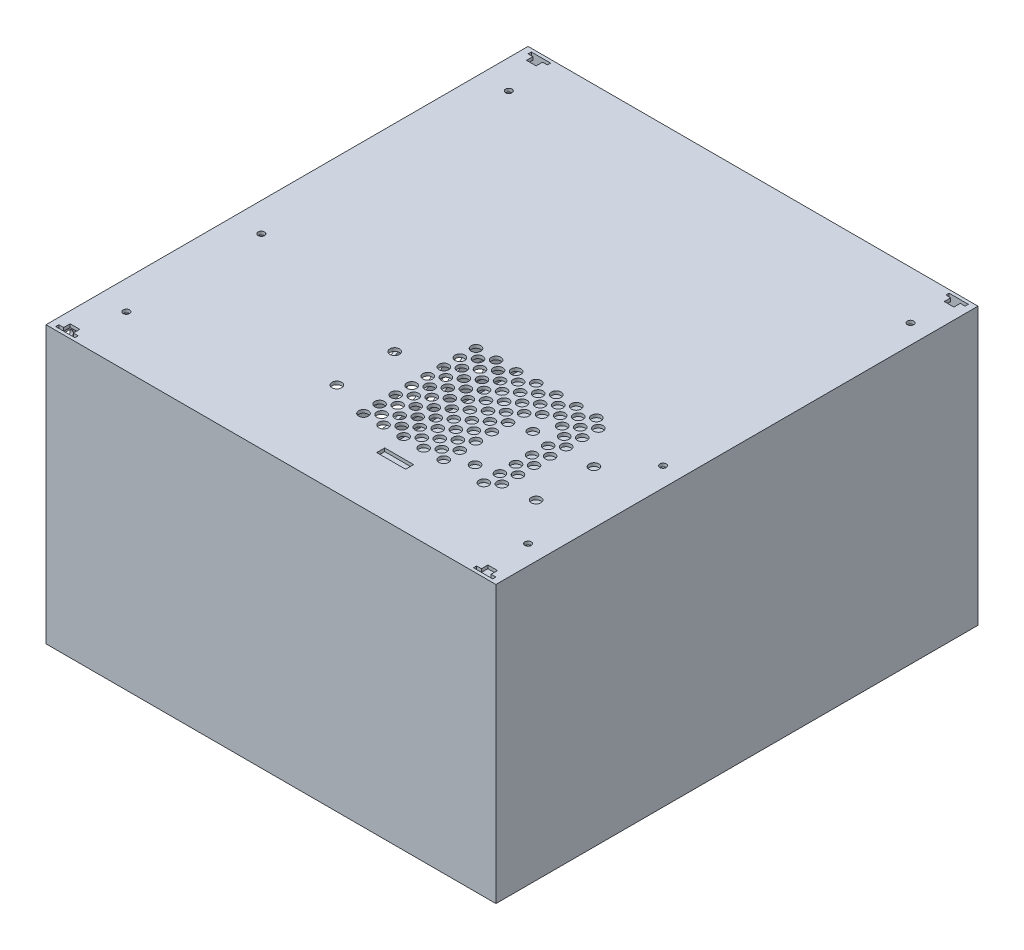
from build123d import *

# Parameters (mm, degrees)
BOSS_EXTRUDE1_DEPTH      = 43
BOSS_EXTRUDE1_DEPTH_BACK = 43
SKETCH1_W                = 140
SKETCH1_H                = 150
SKETCH1_W_2              = 138
SKETCH1_H_2              = 148
SKETCH3_W                = 140
SKETCH3_H                = 150
BOSS_EXTRUDE2_DEPTH      = 1
SKETCH4_W                = 140
SKETCH4_H                = 150
BOSS_EXTRUDE3_DEPTH      = 1
CUT_EXTRUDE2_START       = -1
CUT_EXTRUDE2_OUTLINE_R   = 1
CUT_EXTRUDE2_OUTLINE_R_2 = 1.5
CUT_EXTRUDE2_OUTLINE_W   = 9
CUT_EXTRUDE2_OUTLINE_H   = 2.5
CUT_EXTRUDE2_DEPTH       = 1
SKETCH6_R                = 1.5
SKETCH6_R_2              = 2.5
SKETCH6_R_3              = 2
SKETCH6_R_4              = 1
CUT_EXTRUDE3_DEPTH       = 1


# Read off the part's stored shape, not the designer's step: Cut-Extrude2
with BuildPart() as part:
    # Sketch1 → Boss-Extrude1 (new, two sides: drawn at the far end of the back side and taken through both)
    with BuildSketch(Plane(origin=(0, 0, 0), x_dir=(1, 0, 0), z_dir=(0, 1, 0)).offset(-BOSS_EXTRUDE1_DEPTH_BACK)):
        Rectangle(SKETCH1_W, SKETCH1_H)
        Rectangle(SKETCH1_W_2, SKETCH1_H_2, mode=Mode.SUBTRACT)
    extrude(amount=BOSS_EXTRUDE1_DEPTH + BOSS_EXTRUDE1_DEPTH_BACK)

    # Sketch3 → Boss-Extrude2 (add)
    with BuildSketch(Plane(origin=(0, 43, 0), x_dir=(1, 0, 0), z_dir=(0, 1, 0))):
        Rectangle(SKETCH3_W, SKETCH3_H)
    extrude(amount=-BOSS_EXTRUDE2_DEPTH)

    # Sketch4 → Boss-Extrude3 (add)
    with BuildSketch(Plane.XZ.offset(43)):
        Rectangle(SKETCH4_W, SKETCH4_H)
    extrude(amount=-BOSS_EXTRUDE3_DEPTH)

    # Cut-Extrude2 outline → Cut-Extrude2 (cut)
    with BuildSketch(Plane(origin=(0, 43, 0), x_dir=(1, 0, 0), z_dir=(0, 1, 0)).offset(CUT_EXTRUDE2_START)):
        with Locations((-61, 60)):
            Circle(CUT_EXTRUDE2_OUTLINE_R)
        with Locations((12.662498999, -17)):
            Circle(CUT_EXTRUDE2_OUTLINE_R_2)
        with Locations((12.662498999, -22)):
            Circle(CUT_EXTRUDE2_OUTLINE_R_2)
        with Locations((12.662498999, -27)):
            Circle(CUT_EXTRUDE2_OUTLINE_R_2)
        with Locations((12.662498999, -32)):
            Circle(CUT_EXTRUDE2_OUTLINE_R_2)
        with Locations((12.662498999, -37)):
            Circle(CUT_EXTRUDE2_OUTLINE_R_2)
        with Locations((12.662498999, -42)):
            Circle(CUT_EXTRUDE2_OUTLINE_R_2)
        with Locations((15.78, -39.5)):
            Circle(CUT_EXTRUDE2_OUTLINE_R_2)
        with Locations((15.78, -34.5)):
            Circle(CUT_EXTRUDE2_OUTLINE_R_2)
        with Locations((15.78, -29.5)):
            Circle(CUT_EXTRUDE2_OUTLINE_R_2)
        with Locations((15.78, -24.5)):
            Circle(CUT_EXTRUDE2_OUTLINE_R_2)
        with Locations((15.78, -14.5)):
            Circle(CUT_EXTRUDE2_OUTLINE_R_2)
        with Locations((15.78, -19.5)):
            Circle(CUT_EXTRUDE2_OUTLINE_R_2)
        with Locations((12.662498999, -47)):
            Circle(CUT_EXTRUDE2_OUTLINE_R_2)
        with Locations((9.54, -49.5)):
            Circle(CUT_EXTRUDE2_OUTLINE_R_2)
        with Locations((9.54, -44.5)):
            Circle(CUT_EXTRUDE2_OUTLINE_R_2)
        with Locations((9.54, -39.5)):
            Circle(CUT_EXTRUDE2_OUTLINE_R_2)
        with Locations((9.54, -34.5)):
            Circle(CUT_EXTRUDE2_OUTLINE_R_2)
        with Locations((9.54, -29.5)):
            Circle(CUT_EXTRUDE2_OUTLINE_R_2)
        with Locations((9.54, -24.5)):
            Circle(CUT_EXTRUDE2_OUTLINE_R_2)
        with Locations((9.54, -14.5)):
            Circle(CUT_EXTRUDE2_OUTLINE_R_2)
        with Locations((6.422498999, -47)):
            Circle(CUT_EXTRUDE2_OUTLINE_R_2)
        with Locations((6.422498999, -42)):
            Circle(CUT_EXTRUDE2_OUTLINE_R_2)
        with Locations((6.422498999, -37)):
            Circle(CUT_EXTRUDE2_OUTLINE_R_2)
        with Locations((6.422498999, -32)):
            Circle(CUT_EXTRUDE2_OUTLINE_R_2)
        with Locations((6.422498999, -27)):
            Circle(CUT_EXTRUDE2_OUTLINE_R_2)
        with Locations((6.422498999, -22)):
            Circle(CUT_EXTRUDE2_OUTLINE_R_2)
        with Locations((34.5, -46)):
            Circle(CUT_EXTRUDE2_OUTLINE_R_2)
        with Locations((-8.5, -28)):
            Circle(CUT_EXTRUDE2_OUTLINE_R_2)
        with Locations((-8.5, -46)):
            Circle(CUT_EXTRUDE2_OUTLINE_R_2)
        Polygon((-68, 73), (-66.5, 73), (-66.5, 71), (-63.5, 71), (-63.5, 73), (-62, 73), (-62, 74), (-68, 74), align=None)
        Polygon((68, 74), (62, 74), (62, 73), (63.5, 73), (63.5, 71), (66.5, 71), (66.5, 73), (68, 73), align=None)
        Polygon((-63.5, -71), (-66.5, -71), (-66.5, -73), (-68, -73), (-68, -74), (-62, -74), (-62, -73), (-63.5, -73), align=None)
        Polygon((62, -73), (62, -74), (68, -74), (68, -73), (66.5, -73), (66.5, -71), (63.5, -71), (63.5, -73), align=None)
        with Locations((20.402498999, -56.75)):
            Rectangle(CUT_EXTRUDE2_OUTLINE_W, CUT_EXTRUDE2_OUTLINE_H)
        with Locations((-61, -17)):
            Circle(CUT_EXTRUDE2_OUTLINE_R)
        with Locations((-61, -59)):
            Circle(CUT_EXTRUDE2_OUTLINE_R)
        with Locations((53.5, -28)):
            Circle(CUT_EXTRUDE2_OUTLINE_R_2)
        with Locations((53.5, -46)):
            Circle(CUT_EXTRUDE2_OUTLINE_R_2)
        with Locations((34.5, -28)):
            Circle(CUT_EXTRUDE2_OUTLINE_R_2)
        with Locations((64, -59)):
            Circle(CUT_EXTRUDE2_OUTLINE_R)
        with Locations((64, -17)):
            Circle(CUT_EXTRUDE2_OUTLINE_R)
        with Locations((64, 60)):
            Circle(CUT_EXTRUDE2_OUTLINE_R)
        with Locations((3.3, -29.5)):
            Circle(CUT_EXTRUDE2_OUTLINE_R_2)
        with Locations((3.3, -34.5)):
            Circle(CUT_EXTRUDE2_OUTLINE_R_2)
        with Locations((3.3, -39.5)):
            Circle(CUT_EXTRUDE2_OUTLINE_R_2)
        with Locations((3.3, -44.5)):
            Circle(CUT_EXTRUDE2_OUTLINE_R_2)
        with Locations((3.3, -49.5)):
            Circle(CUT_EXTRUDE2_OUTLINE_R_2)
        with Locations((6.422498999, -17)):
            Circle(CUT_EXTRUDE2_OUTLINE_R_2)
        with Locations((9.54, -19.5)):
            Circle(CUT_EXTRUDE2_OUTLINE_R_2)
        with Locations((3.3, -24.5)):
            Circle(CUT_EXTRUDE2_OUTLINE_R_2)
        with Locations((3.3, -14.5)):
            Circle(CUT_EXTRUDE2_OUTLINE_R_2)
        with Locations((3.3, -19.5)):
            Circle(CUT_EXTRUDE2_OUTLINE_R_2)
        with Locations((28.26, -24.5)):
            Circle(CUT_EXTRUDE2_OUTLINE_R_2)
        with Locations((28.26, -29.5)):
            Circle(CUT_EXTRUDE2_OUTLINE_R_2)
        with Locations((28.26, -34.5)):
            Circle(CUT_EXTRUDE2_OUTLINE_R_2)
        with Locations((28.26, -39.5)):
            Circle(CUT_EXTRUDE2_OUTLINE_R_2)
        with Locations((28.26, -44.5)):
            Circle(CUT_EXTRUDE2_OUTLINE_R_2)
        with Locations((28.26, -49.5)):
            Circle(CUT_EXTRUDE2_OUTLINE_R_2)
        with Locations((34.5, -14.5)):
            Circle(CUT_EXTRUDE2_OUTLINE_R_2)
        with Locations((37.622498999, -17)):
            Circle(CUT_EXTRUDE2_OUTLINE_R_2)
        with Locations((37.622498999, -22)):
            Circle(CUT_EXTRUDE2_OUTLINE_R_2)
        with Locations((40.74, -19.5)):
            Circle(CUT_EXTRUDE2_OUTLINE_R_2)
        with Locations((31.382498999, -17)):
            Circle(CUT_EXTRUDE2_OUTLINE_R_2)
        with Locations((31.382498999, -22)):
            Circle(CUT_EXTRUDE2_OUTLINE_R_2)
        with Locations((34.5, -19.5)):
            Circle(CUT_EXTRUDE2_OUTLINE_R_2)
        with Locations((40.74, -14.5)):
            Circle(CUT_EXTRUDE2_OUTLINE_R_2)
        with Locations((40.74, -24.5)):
            Circle(CUT_EXTRUDE2_OUTLINE_R_2)
        with Locations((40.74, -29.5)):
            Circle(CUT_EXTRUDE2_OUTLINE_R_2)
        with Locations((40.74, -34.5)):
            Circle(CUT_EXTRUDE2_OUTLINE_R_2)
        with Locations((40.74, -39.5)):
            Circle(CUT_EXTRUDE2_OUTLINE_R_2)
        with Locations((40.74, -44.5)):
            Circle(CUT_EXTRUDE2_OUTLINE_R_2)
        with Locations((40.74, -49.5)):
            Circle(CUT_EXTRUDE2_OUTLINE_R_2)
        with Locations((43.862498999, -17)):
            Circle(CUT_EXTRUDE2_OUTLINE_R_2)
        with Locations((43.862498999, -22)):
            Circle(CUT_EXTRUDE2_OUTLINE_R_2)
        with Locations((43.862498999, -27)):
            Circle(CUT_EXTRUDE2_OUTLINE_R_2)
        with Locations((43.862498999, -32)):
            Circle(CUT_EXTRUDE2_OUTLINE_R_2)
        with Locations((43.862498999, -37)):
            Circle(CUT_EXTRUDE2_OUTLINE_R_2)
        with Locations((43.862498999, -42)):
            Circle(CUT_EXTRUDE2_OUTLINE_R_2)
        with Locations((43.862498999, -47)):
            Circle(CUT_EXTRUDE2_OUTLINE_R_2)
        with Locations((22.02, -29.5)):
            Circle(CUT_EXTRUDE2_OUTLINE_R_2)
        with Locations((22.02, -24.5)):
            Circle(CUT_EXTRUDE2_OUTLINE_R_2)
        with Locations((22.02, -14.5)):
            Circle(CUT_EXTRUDE2_OUTLINE_R_2)
        with Locations((22.02, -19.5)):
            Circle(CUT_EXTRUDE2_OUTLINE_R_2)
        with Locations((18.902498999, -47)):
            Circle(CUT_EXTRUDE2_OUTLINE_R_2)
        with Locations((18.902498999, -42)):
            Circle(CUT_EXTRUDE2_OUTLINE_R_2)
        with Locations((18.902498999, -37)):
            Circle(CUT_EXTRUDE2_OUTLINE_R_2)
        with Locations((18.902498999, -17)):
            Circle(CUT_EXTRUDE2_OUTLINE_R_2)
        with Locations((15.78, -49.5)):
            Circle(CUT_EXTRUDE2_OUTLINE_R_2)
        with Locations((15.78, -44.5)):
            Circle(CUT_EXTRUDE2_OUTLINE_R_2)
        with Locations((18.902498999, -22)):
            Circle(CUT_EXTRUDE2_OUTLINE_R_2)
        with Locations((18.902498999, -27)):
            Circle(CUT_EXTRUDE2_OUTLINE_R_2)
        with Locations((18.902498999, -32)):
            Circle(CUT_EXTRUDE2_OUTLINE_R_2)
        with Locations((25.142498999, -27)):
            Circle(CUT_EXTRUDE2_OUTLINE_R_2)
        with Locations((25.142498999, -32)):
            Circle(CUT_EXTRUDE2_OUTLINE_R_2)
        with Locations((25.142498999, -37)):
            Circle(CUT_EXTRUDE2_OUTLINE_R_2)
        with Locations((25.142498999, -42)):
            Circle(CUT_EXTRUDE2_OUTLINE_R_2)
        with Locations((25.142498999, -47)):
            Circle(CUT_EXTRUDE2_OUTLINE_R_2)
        with Locations((28.26, -19.5)):
            Circle(CUT_EXTRUDE2_OUTLINE_R_2)
        with Locations((28.26, -14.5)):
            Circle(CUT_EXTRUDE2_OUTLINE_R_2)
        with Locations((22.02, -34.5)):
            Circle(CUT_EXTRUDE2_OUTLINE_R_2)
        with Locations((22.02, -39.5)):
            Circle(CUT_EXTRUDE2_OUTLINE_R_2)
        with Locations((22.02, -44.5)):
            Circle(CUT_EXTRUDE2_OUTLINE_R_2)
        with Locations((22.02, -49.5)):
            Circle(CUT_EXTRUDE2_OUTLINE_R_2)
        with Locations((25.142498999, -17)):
            Circle(CUT_EXTRUDE2_OUTLINE_R_2)
        with Locations((25.142498999, -22)):
            Circle(CUT_EXTRUDE2_OUTLINE_R_2)
    extrude(amount=CUT_EXTRUDE2_DEPTH, mode=Mode.SUBTRACT)

    # Sketch6 → Cut-Extrude3 (cut)
    with BuildSketch(Plane.ZY.offset(70)):
        with Locations((-69, 37.5)):
            Circle(SKETCH6_R)
        with Locations((-69, -26.5)):
            Circle(SKETCH6_R)
        with Locations(Location((69, 37.5, 0), (0, 0, 180))):
            Circle(SKETCH6_R)
        with Locations((45, -37.5)):
            Circle(SKETCH6_R)
        with Locations((-59, 36)):
            Circle(SKETCH6_R_2)
        with Locations((13, 36)):
            Circle(SKETCH6_R_2)
        with Locations((13, -36)):
            Circle(SKETCH6_R_2)
        with Locations((-59, -36)):
            Circle(SKETCH6_R_2)
        with Locations((28, -1.5)):
            Circle(SKETCH6_R_3)
        with Locations((62, -1.5)):
            Circle(SKETCH6_R_3)
        with Locations((25, -19)):
            Circle(SKETCH6_R_4)
        with Locations((65, -19)):
            Circle(SKETCH6_R_4)
        with BuildLine():
            Line((-44.094074997, 38.5), (-35.56980509, 38.5))
            ThreePointArc((-35.56980509, 38.5), (-51.637824638, 28.637824638), (-61.5, 12.56980509))
            Line((-61.5, 12.56980509), (-61.5, 21.094074997))
            ThreePointArc((-61.5, 21.094074997), (-54.041987694, 31.041987694), (-44.094074997, 38.5))
        make_face()
        with BuildLine():
            Line((-1.905925003, 38.5), (-10.43019491, 38.5))
            ThreePointArc((-10.43019491, 38.5), (5.637824638, 28.637824638), (15.5, 12.56980509))
            Line((15.5, 12.56980509), (15.5, 21.094074997))
            ThreePointArc((15.5, 21.094074997), (8.041987694, 31.041987694), (-1.905925003, 38.5))
        make_face()
        with BuildLine():
            Line((15.5, -21.094074997), (15.5, -12.56980509))
            ThreePointArc((15.5, -12.56980509), (5.637824638, -28.637824638), (-10.43019491, -38.5))
            Line((-10.43019491, -38.5), (-1.905925003, -38.5))
            ThreePointArc((-1.905925003, -38.5), (8.041987694, -31.041987694), (15.5, -21.094074997))
        make_face()
        with BuildLine():
            Line((-44.094074997, -38.5), (-35.56980509, -38.5))
            ThreePointArc((-35.56980509, -38.5), (-51.637824638, -28.637824638), (-61.5, -12.56980509))
            Line((-61.5, -12.56980509), (-61.5, -21.094074997))
            ThreePointArc((-61.5, -21.094074997), (-54.041987694, -31.041987694), (-44.094074997, -38.5))
        make_face()
        Polygon((44.25, -0.75), (45.75, -0.75), (46.760362971, 1), (49.647114317, 1), (51.09048999, -1.5), (49.647114317, -4), (46.760362971, -4), (45.75, -2.25), (44.25, -2.25), (43.239637029, -4), (40.352885683, -4), (38.90951001, -1.5), (40.352885683, 1), (43.239637029, 1), align=None)
        with BuildLine():
            Line((33.5, -28.5), (56.5, -28.5))
            ThreePointArc((56.5, -28.5), (57.914213562, -27.914213562), (58.5, -26.5))
            Line((58.5, -26.5), (58.5, -11.5))
            ThreePointArc((58.5, -11.5), (57.914213562, -10.085786438), (56.5, -9.5))
            Line((56.5, -9.5), (33.5, -9.5))
            ThreePointArc((33.5, -9.5), (32.085786438, -10.085786438), (31.5, -11.5))
            Line((31.5, -11.5), (31.5, -26.5))
            ThreePointArc((31.5, -26.5), (32.085786438, -27.914213562), (33.5, -28.5))
        make_face()
        with BuildLine():
            ThreePointArc((-37.984035323, 14.713214654), (-37.945346656, 10.470750371), (-33.702882373, 10.509439038))
            ThreePointArc((-33.702882373, 10.509439038), (-30.5, 12.990381057), (-26.75, 14.523687548))
            ThreePointArc((-26.75, 14.523687548), (-24.59526249, 18.178425058), (-28.25, 20.333162568))
            ThreePointArc((-28.25, 20.333162568), (-33.5, 18.186533479), (-37.984035323, 14.713214654))
        make_face()
        with BuildLine():
            ThreePointArc((-45.671992068, 18.874076817), (-45.285763398, 14.649052862), (-41.060739444, 15.035281532))
            ThreePointArc((-41.060739444, 15.035281532), (-34.75, 20.351596989), (-26.990566038, 23.158699935))
            ThreePointArc((-26.990566038, 23.158699935), (-24.543570221, 26.624563677), (-28.009433962, 29.071559493))
            ThreePointArc((-28.009433962, 29.071559493), (-37.75, 25.547749412), (-45.671992068, 18.874076817))
        make_face()
        with BuildLine():
            ThreePointArc((-53.192972047, 23.073457455), (-52.630905106, 18.868213021), (-48.425660672, 19.430279962))
            ThreePointArc((-48.425660672, 19.430279962), (-39, 27.712812921), (-27.114285714, 31.734408031))
            ThreePointArc((-27.114285714, 31.734408031), (-24.524899247, 35.095223069), (-27.885714286, 37.684609536))
            ThreePointArc((-27.885714286, 37.684609536), (-42, 32.908965344), (-53.192972047, 23.073457455))
        make_face()
        with BuildLine():
            ThreePointArc((-12.297117627, 10.509439038), (-15.5, 12.990381057), (-19.25, 14.523687548))
            ThreePointArc((-19.25, 14.523687548), (-21.40473751, 18.178425058), (-17.75, 20.333162568))
            ThreePointArc((-17.75, 20.333162568), (-12.5, 18.186533479), (-8.015964677, 14.713214654))
            ThreePointArc((-8.015964677, 14.713214654), (-8.054653344, 10.470750371), (-12.297117627, 10.509439038))
        make_face()
        with BuildLine():
            ThreePointArc((-17.990566038, 29.071559493), (-21.456429779, 26.624563677), (-19.009433962, 23.158699935))
            ThreePointArc((-19.009433962, 23.158699935), (-11.25, 20.351596989), (-4.939260556, 15.035281532))
            ThreePointArc((-4.939260556, 15.035281532), (-0.714236602, 14.649052862), (-0.328007932, 18.874076817))
            ThreePointArc((-0.328007932, 18.874076817), (-8.25, 25.547749412), (-17.990566038, 29.071559493))
        make_face()
        with BuildLine():
            ThreePointArc((2.425660672, 19.430279962), (-7, 27.712812921), (-18.885714286, 31.734408031))
            ThreePointArc((-18.885714286, 31.734408031), (-21.475100753, 35.095223069), (-18.114285714, 37.684609536))
            ThreePointArc((-18.114285714, 37.684609536), (-4, 32.908965344), (7.192972047, 23.073457455))
            ThreePointArc((7.192972047, 23.073457455), (6.630905106, 18.868213021), (2.425660672, 19.430279962))
        make_face()
        with BuildLine():
            ThreePointArc((-8.547117627, -4.01424851), (-8, 0), (-8.547117627, 4.01424851))
            ThreePointArc((-8.547117627, 4.01424851), (-6.459390854, 7.707674687), (-2.765964677, 5.619947914))
            ThreePointArc((-2.765964677, 5.619947914), (-2, 0), (-2.765964677, -5.619947914))
            ThreePointArc((-2.765964677, -5.619947914), (-6.459390854, -7.707674687), (-8.547117627, -4.01424851))
        make_face()
        with BuildLine():
            ThreePointArc((4.68142603, 10.197482677), (0.829333619, 11.975510814), (-0.948694518, 8.123418404))
            ThreePointArc((-0.948694518, 8.123418404), (0.5, 0), (-0.948694518, -8.123418404))
            ThreePointArc((-0.948694518, -8.123418404), (0.829333619, -11.975510814), (4.68142603, -10.197482677))
            ThreePointArc((4.68142603, -10.197482677), (6.5, 0), (4.68142603, 10.197482677))
        make_face()
        with BuildLine():
            ThreePointArc((6.539946386, -12.304128068), (9, 0), (6.539946386, 12.304128068))
            ThreePointArc((6.539946386, 12.304128068), (8.155804353, 16.227010048), (12.078686333, 14.611152081))
            ThreePointArc((12.078686333, 14.611152081), (15, 0), (12.078686333, -14.611152081))
            ThreePointArc((12.078686333, -14.611152081), (8.155804353, -16.227010048), (6.539946386, -12.304128068))
        make_face()
        with BuildLine():
            ThreePointArc((-19.25, -14.523687548), (-15.5, -12.990381057), (-12.297117627, -10.509439038))
            ThreePointArc((-12.297117627, -10.509439038), (-8.054653344, -10.470750371), (-8.015964677, -14.713214654))
            ThreePointArc((-8.015964677, -14.713214654), (-12.5, -18.186533479), (-17.75, -20.333162568))
            ThreePointArc((-17.75, -20.333162568), (-21.40473751, -18.178425058), (-19.25, -14.523687548))
        make_face()
        with BuildLine():
            ThreePointArc((-0.328007932, -18.874076817), (-0.714236602, -14.649052862), (-4.939260556, -15.035281532))
            ThreePointArc((-4.939260556, -15.035281532), (-11.25, -20.351596989), (-19.009433962, -23.158699935))
            ThreePointArc((-19.009433962, -23.158699935), (-21.456429779, -26.624563677), (-17.990566038, -29.071559493))
            ThreePointArc((-17.990566038, -29.071559493), (-8.25, -25.547749412), (-0.328007932, -18.874076817))
        make_face()
        with BuildLine():
            ThreePointArc((-18.885714286, -31.734408031), (-7, -27.712812921), (2.425660672, -19.430279962))
            ThreePointArc((2.425660672, -19.430279962), (6.630905106, -18.868213021), (7.192972047, -23.073457455))
            ThreePointArc((7.192972047, -23.073457455), (-4, -32.908965344), (-18.114285714, -37.684609536))
            ThreePointArc((-18.114285714, -37.684609536), (-21.475100753, -35.095223069), (-18.885714286, -31.734408031))
        make_face()
        with BuildLine():
            ThreePointArc((-33.702882373, -10.509439038), (-30.5, -12.990381057), (-26.75, -14.523687548))
            ThreePointArc((-26.75, -14.523687548), (-24.59526249, -18.178425058), (-28.25, -20.333162568))
            ThreePointArc((-28.25, -20.333162568), (-33.5, -18.186533479), (-37.984035323, -14.713214654))
            ThreePointArc((-37.984035323, -14.713214654), (-37.945346656, -10.470750371), (-33.702882373, -10.509439038))
        make_face()
        with BuildLine():
            ThreePointArc((-28.009433962, -29.071559493), (-24.543570221, -26.624563677), (-26.990566038, -23.158699935))
            ThreePointArc((-26.990566038, -23.158699935), (-34.75, -20.351596989), (-41.060739444, -15.035281532))
            ThreePointArc((-41.060739444, -15.035281532), (-45.285763398, -14.649052862), (-45.671992068, -18.874076817))
            ThreePointArc((-45.671992068, -18.874076817), (-37.75, -25.547749412), (-28.009433962, -29.071559493))
        make_face()
        with BuildLine():
            ThreePointArc((-48.425660672, -19.430279962), (-39, -27.712812921), (-27.114285714, -31.734408031))
            ThreePointArc((-27.114285714, -31.734408031), (-24.524899247, -35.095223069), (-27.885714286, -37.684609536))
            ThreePointArc((-27.885714286, -37.684609536), (-42, -32.908965344), (-53.192972047, -23.073457455))
            ThreePointArc((-53.192972047, -23.073457455), (-52.630905106, -18.868213021), (-48.425660672, -19.430279962))
        make_face()
        with BuildLine():
            ThreePointArc((-37.452882373, 4.01424851), (-38, 0), (-37.452882373, -4.01424851))
            ThreePointArc((-37.452882373, -4.01424851), (-39.540609146, -7.707674687), (-43.234035323, -5.619947914))
            ThreePointArc((-43.234035323, -5.619947914), (-44, 0), (-43.234035323, 5.619947914))
            ThreePointArc((-43.234035323, 5.619947914), (-39.540609146, 7.707674687), (-37.452882373, 4.01424851))
        make_face()
        with BuildLine():
            ThreePointArc((-50.68142603, -10.197482677), (-46.829333619, -11.975510814), (-45.051305482, -8.123418404))
            ThreePointArc((-45.051305482, -8.123418404), (-46.5, 0), (-45.051305482, 8.123418404))
            ThreePointArc((-45.051305482, 8.123418404), (-46.829333619, 11.975510814), (-50.68142603, 10.197482677))
            ThreePointArc((-50.68142603, 10.197482677), (-52.5, 0), (-50.68142603, -10.197482677))
        make_face()
        with BuildLine():
            ThreePointArc((-52.539946386, 12.304128068), (-55, 0), (-52.539946386, -12.304128068))
            ThreePointArc((-52.539946386, -12.304128068), (-54.155804353, -16.227010048), (-58.078686333, -14.611152081))
            ThreePointArc((-58.078686333, -14.611152081), (-61, 0), (-58.078686333, 14.611152081))
            ThreePointArc((-58.078686333, 14.611152081), (-54.155804353, 16.227010048), (-52.539946386, 12.304128068))
        make_face()
    extrude(amount=-CUT_EXTRUDE3_DEPTH, mode=Mode.SUBTRACT)


solid = part.part
